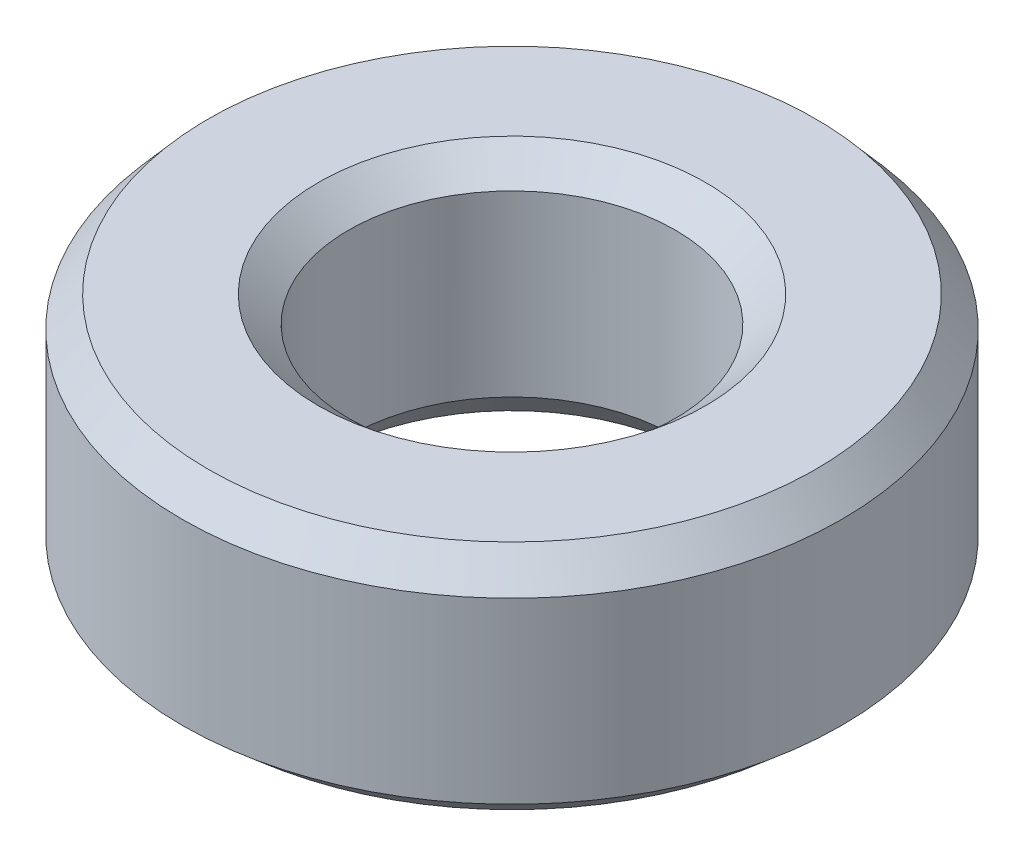
from build123d import *
from OCP.BRepFilletAPI import BRepFilletAPI_MakeChamfer

# Parameters (mm, degrees)
SKETCH1_R           = 27.5
BOSS_EXTRUDE1_DEPTH = 19.584932114
SKETCH2_R           = 13.617614822
CUT_EXTRUDE1_DEPTH  = 44.543880924
CHAMFER1_SIZE       = 2.526437955
CHAMFER1_SIZE2      = 2.175097318


with BuildPart() as part:
    # Sketch1 → Boss-Extrude1 (new body)
    with BuildSketch(Plane(origin=(0, 0, 0), x_dir=(1, 0, 0), z_dir=(0, 1, 0))):
        Circle(SKETCH1_R)
    extrude(amount=BOSS_EXTRUDE1_DEPTH)

    # Sketch2 → Cut-Extrude1 (cut, through all)
    with BuildSketch(Plane(origin=(0, 0, 0), x_dir=(1, 0, 0), z_dir=(0, 1, 0))):
        Circle(SKETCH2_R)
    extrude(amount=CUT_EXTRUDE1_DEPTH, mode=Mode.SUBTRACT)

    # Chamfer1: one chamfer whose edges measure the first distance from different faces: ONE call of the kernel's chamfer builder (chamfer() names one face for all edges)
    chamfer1_edges_1 = [part.edges().sort_by_distance(p)[0] for p in [
        (-13.617614822, 19.584932114, 0),
    ]]
    chamfer1_side_1 = [part.faces().sort_by_distance(p)[0] for p in [
        (-26.722182541, 19.584932114, 0),
    ]]
    chamfer1_edges_2 = [part.edges().sort_by_distance(p)[0] for p in [
        (-13.617614822, 0, 0),
    ]]
    chamfer1_side_2 = [part.faces().sort_by_distance(p)[0] for p in [
        (-13.617614822, 9.792466057, 0),
    ]]
    chamfer1_edges_3 = [part.edges().sort_by_distance(p)[0] for p in [
        (-27.5, 0, 0),
    ]]
    chamfer1_side_3 = [part.faces().sort_by_distance(p)[0] for p in [
        (-26.722182541, 0, 0),
    ]]
    chamfer1_edges_4 = [part.edges().sort_by_distance(p)[0] for p in [
        (-27.5, 19.584932114, 0),
    ]]
    chamfer1_side_4 = [part.faces().sort_by_distance(p)[0] for p in [
        (-27.5, 9.792466057, 0),
    ]]
    chamfer1 = BRepFilletAPI_MakeChamfer(part.part.solid().wrapped)
    for e in chamfer1_edges_1:
        chamfer1.Add(CHAMFER1_SIZE, CHAMFER1_SIZE2, e.wrapped, chamfer1_side_1[0].wrapped)  # the first distance lies on this face
    for e in chamfer1_edges_2:
        chamfer1.Add(CHAMFER1_SIZE, CHAMFER1_SIZE2, e.wrapped, chamfer1_side_2[0].wrapped)  # the first distance lies on this face
    for e in chamfer1_edges_3:
        chamfer1.Add(CHAMFER1_SIZE, CHAMFER1_SIZE2, e.wrapped, chamfer1_side_3[0].wrapped)  # the first distance lies on this face
    for e in chamfer1_edges_4:
        chamfer1.Add(CHAMFER1_SIZE, CHAMFER1_SIZE2, e.wrapped, chamfer1_side_4[0].wrapped)  # the first distance lies on this face
    add(Compound.cast(chamfer1.Shape()), mode=Mode.REPLACE)


solid = part.part
